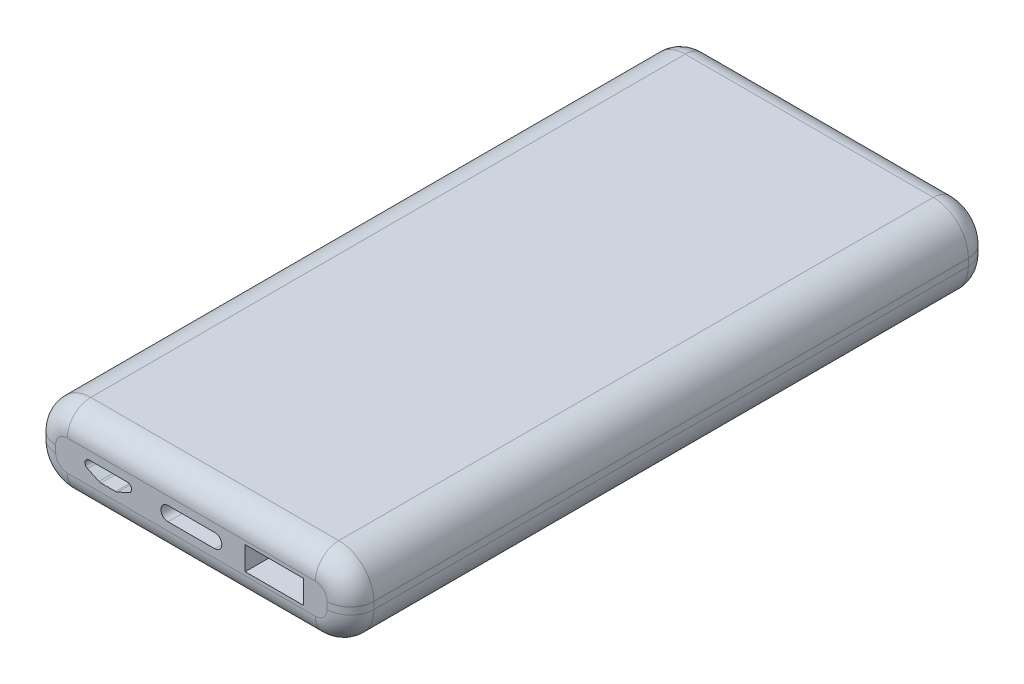
from build123d import *

# Parameters (mm, degrees)
ESQUISSE1_W             = 68
ESQUISSE1_H             = 16.5
BOSS_EXTRU_1_DEPTH      = 137
CONG_1_R                = 7.5
CONG_2_R                = 5
ESQUISSE2_W             = 12.5
ESQUISSE2_H             = 5
ENL_V_MAT_EXTRU_1_DEPTH = 5
CONG_3_R                = 1


with BuildPart() as part:
    # Esquisse1 → Boss.-Extru.1 (new body)
    with BuildSketch(Plane.XY):
        Rectangle(ESQUISSE1_W, ESQUISSE1_H)
    extrude(amount=BOSS_EXTRU_1_DEPTH)

    # Congé1
    cong_1_edges = [part.edges().sort_by_distance(p)[0] for p in [
        (-34, 8.25, 68.5),
        (34, 8.25, 68.5),
        (34, -8.25, 68.5),
        (-34, -8.25, 68.5),
    ]]
    fillet(cong_1_edges, radius=CONG_1_R)

    # Congé2
    cong_2_edges = [part.edges().sort_by_distance(p)[0] for p in [
        (34, 0, 0),
        (34, 0, 137),
        (-34, 0, 0),
        (0, 8.25, 0),
        (0, -8.25, 0),
        (-31.803300859, 6.053300859, 0),
        (-31.803300859, -6.053300859, 0),
        (31.803300859, 6.053300859, 0),
        (31.803300859, -6.053300859, 0),
        (0, -8.25, 137),
        (-34, 0, 137),
        (0, 8.25, 137),
        (-31.803300859, 6.053300859, 137),
        (-31.803300859, -6.053300859, 137),
        (31.803300859, 6.053300859, 137),
        (31.803300859, -6.053300859, 137),
    ]]
    fillet(cong_2_edges, radius=CONG_2_R)

    # Esquisse2 → Enlèv. mat.-Extru.1 (cut)
    with BuildSketch(Plane.XY.offset(137)):
        Polygon((-12.75, 1.5), (-22.75, 1.5), (-22.75, 0), (-19.52732972, -1.5), (-15.97267028, -1.5), (-12.75, 0), align=None)
        with BuildLine():
            Line((5, 1.5), (-5, 1.5))
            ThreePointArc((-5, 1.5), (-6.5, 0), (-5, -1.5))
            Line((-5, -1.5), (5, -1.5))
            ThreePointArc((5, -1.5), (6.5, 0), (5, 1.5))
        make_face()
        with Locations((17.75, 0)):
            Rectangle(ESQUISSE2_W, ESQUISSE2_H)
    extrude(amount=-ENL_V_MAT_EXTRU_1_DEPTH, mode=Mode.SUBTRACT)

    # Congé3
    # the kernel refuses this fillet: 1 mm, written as the material it adds along each edge
    with BuildSketch(Plane(origin=(-15.97267028, -1.5, 137), x_dir=(0.9066045100812768, 0.4219813530243817, 0), z_dir=(0, 0, -1)), Plane(origin=(-19.52732972, -1.5, 137), x_dir=(1, 0, 0), z_dir=(0, 0, -1))) as cong_3_piece_1:
        with BuildLine():
            CenterArc((CONG_3_R * 0.221326106591, -CONG_3_R), CONG_3_R, 90, 24.959741925)
            Line((-CONG_3_R * 0.200655246434, -CONG_3_R * 0.0933954899187), (0, 0))
            Line((0, 0), (CONG_3_R * 0.221326106591, 0))
        make_face()
    extrude(amount=5.553315266)
    with BuildSketch(Plane(origin=(-22.75, 0, 137), x_dir=(0.9066045100812758, -0.42198135302438383, 0), z_dir=(0, 0, -1))) as cong_3_piece_2:
        with BuildLine():
            CenterArc((CONG_3_R * 0.637564274773, -CONG_3_R), CONG_3_R, 90, 65.040258075)
            Line((-CONG_3_R * 0.269040235309, -CONG_3_R * 0.578018646976), (0, 0))
            Line((0, 0), (CONG_3_R * 0.637564274773, 0))
        make_face()
    extrude(amount=6.593910687)
    with BuildSketch(Plane(origin=(-22.75, 1.5, 137), x_dir=(0, -1, 0), z_dir=(0, 0, -1)), Plane(origin=(-12.75, 1.5, 137), x_dir=(-1, 0, 0), z_dir=(0, 0, -1))) as cong_3_piece_3:
        with BuildLine():
            CenterArc((CONG_3_R, -CONG_3_R), CONG_3_R, 90, 90)
            Line((0, -CONG_3_R), (0, 0))
            Line((0, 0), (CONG_3_R, 0))
        make_face()
    extrude(amount=7.5)
    with BuildSketch(Plane(origin=(-12.75, 0, 137), x_dir=(-0.906604510081276, -0.4219813530243839, 0), z_dir=(0, 0, -1))) as cong_3_piece_4:
        with BuildLine():
            CenterArc((CONG_3_R * 0.637564274773, CONG_3_R), CONG_3_R, 204.959741925, 65.040258075)
            Line((-CONG_3_R * 0.269040235309, CONG_3_R * 0.578018646976), (0, 0))
            Line((0, 0), (CONG_3_R * 0.637564274773, 0))
        make_face()
    extrude(amount=6.593910687)


solid = part.part
